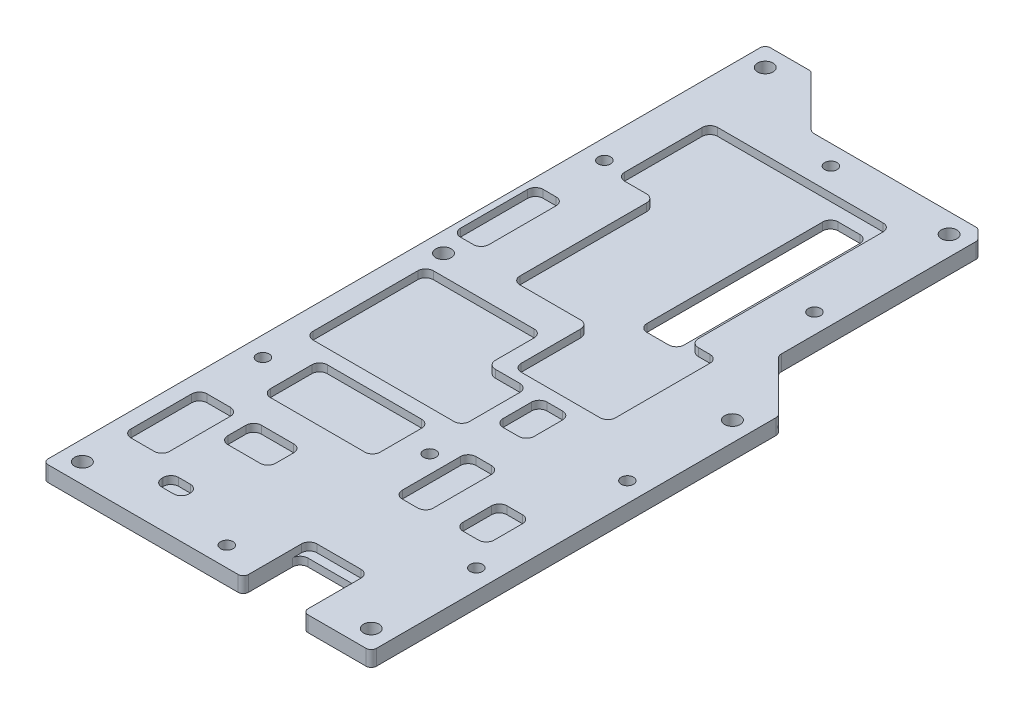
from build123d import *

# Parameters (mm, degrees)
BOSS_EXTRUDE1_DEPTH                                 = 3
CUT_EXTRUDE1_DEPTH                                  = 1.5
CUT_EXTRUDE2_REACH                                  = 155.484
F_3_0MM_DOWEL_HOLE1_D                               = 3
CSK_FOR_M2_COUNTERSUNK_FLAT_HEAD_SCREW1_D           = 2.4
CSK_FOR_M2_COUNTERSUNK_FLAT_HEAD_SCREW1_CSINK_D     = 4.4
CSK_FOR_M2_COUNTERSUNK_FLAT_HEAD_SCREW1_CSINK_ANGLE = 90


with BuildPart() as part:
    # Sketch1 → Boss-Extrude1 (new body)
    with BuildSketch(Plane(origin=(0, 0, 0), x_dir=(1, 0, 0), z_dir=(0, 1, 0))):
        with BuildLine():
            Line((0, 1), (0, 138.7))
            ThreePointArc((0, 138.7), (0.292893219, 139.407106781), (1, 139.7))
            Line((1, 139.7), (8.475786438, 139.7))
            ThreePointArc((8.475786438, 139.7), (8.85846987, 139.623879533), (9.182893219, 139.407106781))
            Line((9.182893219, 139.407106781), (18.610660172, 129.979339828))
            ThreePointArc((18.610660172, 129.979339828), (19.097295195, 129.654180701), (19.671320344, 129.54))
            Line((19.671320344, 129.54), (50.895786438, 129.54))
            ThreePointArc((50.895786438, 129.54), (51.27846987, 129.463879533), (51.602893219, 129.247106781))
            Line((51.602893219, 129.247106781), (53.047106781, 127.802893219))
            ThreePointArc((53.047106781, 127.802893219), (53.263879533, 127.47846987), (53.34, 127.095786438))
            Line((53.34, 127.095786438), (53.34, 89.521320344))
            ThreePointArc((53.34, 89.521320344), (53.454180701, 88.947295195), (53.779339828, 88.460660172))
            Line((53.779339828, 88.460660172), (63.207106781, 79.032893219))
            ThreePointArc((63.207106781, 79.032893219), (63.423879533, 78.70846987), (63.5, 78.325786438))
            Line((63.5, 78.325786438), (63.5, 1))
            ThreePointArc((63.5, 1), (63.207106781, 0.292893219), (62.5, 0))
            Line((62.5, 0), (51.25, 0))
            ThreePointArc((51.25, 0), (50.542893219, 0.292893219), (50.25, 1))
            Line((50.25, 1), (50.25, 9.5))
            ThreePointArc((50.25, 9.5), (49.810660172, 10.560660172), (48.75, 11))
            Line((48.75, 11), (40.25, 11))
            ThreePointArc((40.25, 11), (39.189339828, 10.560660172), (38.75, 9.5))
            Line((38.75, 9.5), (38.75, 1))
            ThreePointArc((38.75, 1), (38.457106781, 0.292893219), (37.75, 0))
            Line((37.75, 0), (1, 0))
            ThreePointArc((1, 0), (0.292893219, 0.292893219), (0, 1))
        make_face()
    extrude(amount=BOSS_EXTRUDE1_DEPTH)

    # Sketch2 → Cut-Extrude1 (cut)
    with BuildSketch(Plane(origin=(0, 3, 0), x_dir=(1, 0, 0), z_dir=(0, 1, 0))):
        with BuildLine():
            Line((50.25, 0), (50.25, 11.25))
            ThreePointArc((50.25, 11.25), (49.810660172, 12.310660172), (48.75, 12.75))
            Line((48.75, 12.75), (40.25, 12.75))
            ThreePointArc((40.25, 12.75), (39.189339828, 12.310660172), (38.75, 11.25))
            Line((38.75, 11.25), (38.75, 0))
            Line((38.75, 0), (50.25, 0))
        make_face()
        with BuildLine():
            Line((52.25, 37.5), (55.25, 37.5))
            ThreePointArc((55.25, 37.5), (56.310660172, 37.060660172), (56.75, 36))
            Line((56.75, 36), (56.75, 30.5))
            ThreePointArc((56.75, 30.5), (56.310660172, 29.439339828), (55.25, 29))
            Line((55.25, 29), (52.25, 29))
            ThreePointArc((52.25, 29), (51.189339828, 29.439339828), (50.75, 30.5))
            Line((50.75, 30.5), (50.75, 36))
            ThreePointArc((50.75, 36), (51.189339828, 37.060660172), (52.25, 37.5))
        make_face()
        with BuildLine():
            Line((41, 42.75), (44, 42.75))
            ThreePointArc((44, 42.75), (45.060660172, 42.310660172), (45.5, 41.25))
            Line((45.5, 41.25), (45.5, 30))
            ThreePointArc((45.5, 30), (45.060660172, 28.939339828), (44, 28.5))
            Line((44, 28.5), (41, 28.5))
            ThreePointArc((41, 28.5), (39.939339828, 28.939339828), (39.5, 30))
            Line((39.5, 30), (39.5, 41.25))
            ThreePointArc((39.5, 41.25), (39.939339828, 42.310660172), (41, 42.75))
        make_face()
        with BuildLine():
            Line((11.25, 43.75), (29.5, 43.75))
            ThreePointArc((29.5, 43.75), (30.560660172, 43.310660172), (31, 42.25))
            Line((31, 42.25), (31, 34.25))
            ThreePointArc((31, 34.25), (30.560660172, 33.189339828), (29.5, 32.75))
            Line((29.5, 32.75), (11.25, 32.75))
            ThreePointArc((11.25, 32.75), (10.189339828, 33.189339828), (9.75, 34.25))
            Line((9.75, 34.25), (9.75, 42.25))
            ThreePointArc((9.75, 42.25), (10.189339828, 43.310660172), (11.25, 43.75))
        make_face()
        with BuildLine():
            Line((18, 10.5), (15.75, 10.5))
            ThreePointArc((15.75, 10.5), (14.689339828, 10.060660172), (14.25, 9))
            Line((14.25, 9), (14.25, 8.75))
            ThreePointArc((14.25, 8.75), (14.689339828, 7.689339828), (15.75, 7.25))
            Line((15.75, 7.25), (18, 7.25))
            ThreePointArc((18, 7.25), (19.060660172, 7.689339828), (19.5, 8.75))
            Line((19.5, 8.75), (19.5, 9))
            ThreePointArc((19.5, 9), (19.060660172, 10.060660172), (18, 10.5))
        make_face()
        with BuildLine():
            Line((4.25, 68.25), (4.25, 48))
            ThreePointArc((4.25, 48), (4.689339828, 46.939339828), (5.75, 46.5))
            Line((5.75, 46.5), (33, 46.5))
            ThreePointArc((33, 46.5), (34.060660172, 46.939339828), (34.5, 48))
            Line((34.5, 48), (34.5, 57.75))
            ThreePointArc((34.5, 57.75), (34.060660172, 58.810660172), (33, 59.25))
            Line((33, 59.25), (28.25, 59.25))
            ThreePointArc((28.25, 59.25), (27.189339828, 59.689339828), (26.75, 60.75))
            Line((26.75, 60.75), (26.75, 68.25))
            ThreePointArc((26.75, 68.25), (26.310660172, 69.310660172), (25.25, 69.75))
            Line((25.25, 69.75), (5.75, 69.75))
            ThreePointArc((5.75, 69.75), (4.689339828, 69.310660172), (4.25, 68.25))
        make_face()
        with BuildLine():
            Line((4.5, 27.25), (9, 27.25))
            ThreePointArc((9, 27.25), (10.060660172, 26.810660172), (10.5, 25.75))
            Line((10.5, 25.75), (10.5, 14))
            ThreePointArc((10.5, 14), (10.060660172, 12.939339828), (9, 12.5))
            Line((9, 12.5), (4.5, 12.5))
            ThreePointArc((4.5, 12.5), (3.439339828, 12.939339828), (3, 14))
            Line((3, 14), (3, 25.75))
            ThreePointArc((3, 25.75), (3.439339828, 26.810660172), (4.5, 27.25))
        make_face()
        with BuildLine():
            Line((15, 27.25), (21.25, 27.25))
            ThreePointArc((21.25, 27.25), (22.310660172, 26.810660172), (22.75, 25.75))
            Line((22.75, 25.75), (22.75, 22.25))
            ThreePointArc((22.75, 22.25), (22.310660172, 21.189339828), (21.25, 20.75))
            Line((21.25, 20.75), (15, 20.75))
            ThreePointArc((15, 20.75), (13.939339828, 21.189339828), (13.5, 22.25))
            Line((13.5, 22.25), (13.5, 25.75))
            ThreePointArc((13.5, 25.75), (13.939339828, 26.810660172), (15, 27.25))
        make_face()
        with BuildLine():
            Line((31.25, 61.25), (46.5, 61.25))
            ThreePointArc((46.5, 61.25), (47.560660172, 61.689339828), (48, 62.75))
            Line((48, 62.75), (48, 81))
            ThreePointArc((48, 81), (47.560660172, 82.060660172), (46.5, 82.5))
            Line((46.5, 82.5), (44.25, 82.5))
            ThreePointArc((44.25, 82.5), (43.189339828, 82.939339828), (42.75, 84))
            Line((42.75, 84), (42.75, 119.75))
            ThreePointArc((42.75, 119.75), (42.310660172, 120.810660172), (41.25, 121.25))
            Line((41.25, 121.25), (9.25, 121.25))
            ThreePointArc((9.25, 121.25), (8.189339828, 120.810660172), (7.75, 119.75))
            Line((7.75, 119.75), (7.75, 104.75))
            ThreePointArc((7.75, 104.75), (8.189339828, 103.689339828), (9.25, 103.25))
            Line((9.25, 103.25), (13.5, 103.25))
            ThreePointArc((13.5, 103.25), (14.560660172, 102.810660172), (15, 101.75))
            Line((15, 101.75), (15, 77.25))
            ThreePointArc((15, 77.25), (15.439339828, 76.189339828), (16.5, 75.75))
            Line((16.5, 75.75), (28.25, 75.75))
            ThreePointArc((28.25, 75.75), (29.310660172, 75.310660172), (29.75, 74.25))
            Line((29.75, 74.25), (29.75, 62.75))
            ThreePointArc((29.75, 62.75), (30.189339828, 61.689339828), (31.25, 61.25))
        make_face()
        with BuildLine():
            Line((38.75, 58.75), (41.75, 58.75))
            ThreePointArc((41.75, 58.75), (42.810660172, 58.310660172), (43.25, 57.25))
            Line((43.25, 57.25), (43.25, 51.75))
            ThreePointArc((43.25, 51.75), (42.810660172, 50.689339828), (41.75, 50.25))
            Line((41.75, 50.25), (38.75, 50.25))
            ThreePointArc((38.75, 50.25), (37.689339828, 50.689339828), (37.25, 51.75))
            Line((37.25, 51.75), (37.25, 57.25))
            ThreePointArc((37.25, 57.25), (37.689339828, 58.310660172), (38.75, 58.75))
        make_face()
        with BuildLine():
            Line((2.75, 94), (5.25, 94))
            ThreePointArc((5.25, 94), (6.310660172, 93.560660172), (6.75, 92.5))
            Line((6.75, 92.5), (6.75, 79.5))
            ThreePointArc((6.75, 79.5), (6.310660172, 78.439339828), (5.25, 78))
            Line((5.25, 78), (2.75, 78))
            ThreePointArc((2.75, 78), (1.689339828, 78.439339828), (1.25, 79.5))
            Line((1.25, 79.5), (1.25, 92.5))
            ThreePointArc((1.25, 92.5), (1.689339828, 93.560660172), (2.75, 94))
        make_face()
    extrude(amount=-CUT_EXTRUDE1_DEPTH, mode=Mode.SUBTRACT)

    # Sketch3 → Cut-Extrude2 (cut, up to next)
    with BuildSketch(Plane(origin=(0, 0, 0), x_dir=(-1, 0, 0), z_dir=(0, -1, 0)), mode=Mode.PRIVATE) as cut_extrude2_sk1:
        with BuildLine():
            Line((-39.44, 118.58), (-35.24, 118.58))
            ThreePointArc((-35.24, 118.58), (-34.179339828, 118.140660172), (-33.74, 117.08))
            Line((-33.74, 117.08), (-33.74, 83.08))
            ThreePointArc((-33.74, 83.08), (-34.179339828, 82.019339828), (-35.24, 81.58))
            Line((-35.24, 81.58), (-39.44, 81.58))
            ThreePointArc((-39.44, 81.58), (-40.500660172, 82.019339828), (-40.94, 83.08))
            Line((-40.94, 83.08), (-40.94, 117.08))
            ThreePointArc((-40.94, 117.08), (-40.500660172, 118.140660172), (-39.44, 118.58))
        make_face()
    cut_extrude2_tool1 = extrude(cut_extrude2_sk1.sketch, amount=-CUT_EXTRUDE2_REACH, mode=Mode.PRIVATE) & part.part
    add(cut_extrude2_tool1.solids().sort_by_distance((37.34, 0, -100.08))[0], mode=Mode.SUBTRACT)

    # Ø3.0mm Dowel Hole1 (through all)
    with Locations(Plane(origin=(0, 3, 0), x_dir=(1, 0, 0), z_dir=(0, 1, 0))):
        with Locations((3.81, 135.89), (49.53, 125.73), (59.69, 73.66), (59.69, 3.81), (3.81, 3.81), (3.81, 73.66)):
            Hole(F_3_0MM_DOWEL_HOLE1_D / 2)

    # CSK for M2 Countersunk Flat Head Screw1 (through all)
    with Locations(Plane(origin=(0, 0, 0), x_dir=(-1, 0, 0), z_dir=(0, -1, 0))):
        with Locations((-26.67, 125.73), (-31.75, 3.81), (-59.69, 53.34), (-3.81, 38.74), (-36.07, 38.74), (-59.69, 24.13), (-49.53, 99.69), (-3.81, 104.77)):
            CounterSinkHole(CSK_FOR_M2_COUNTERSUNK_FLAT_HEAD_SCREW1_D / 2, CSK_FOR_M2_COUNTERSUNK_FLAT_HEAD_SCREW1_CSINK_D / 2, counter_sink_angle=CSK_FOR_M2_COUNTERSUNK_FLAT_HEAD_SCREW1_CSINK_ANGLE)


solid = part.part
